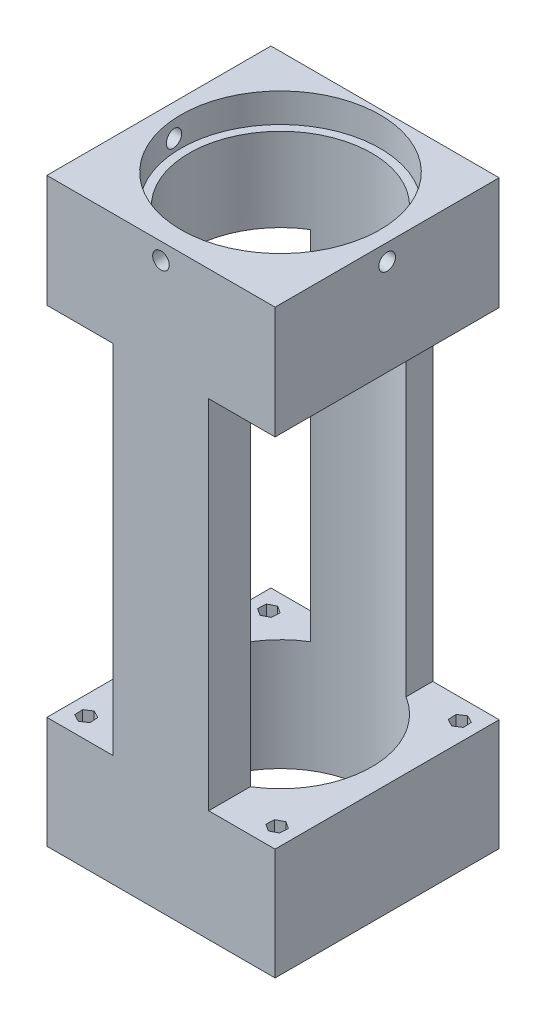
from build123d import *

# Parameters (mm, degrees)
SKETCH_1_W               = 55
SKETCH_1_H               = 140
EXTRUDE_1_DEPTH          = 54
SKETCH_2_R               = 22
CUT_EXTRUDE_1_DEPTH      = 153.552449997
CUT_EXTRUDE_2_REACH      = 94.586
SKETCH_3_W               = 16
SKETCH_3_H               = 86
SKETCH_4_R               = 24
CUT_EXTRUDE_3_DEPTH      = 7
SKETCH_5_R               = 2
CUT_EXTRUDE_4_DEPTH      = 105.120122935
SKETCH_6_R               = 2
CUT_EXTRUDE_5_DEPTH      = 20
CUT_EXTRUDE_6_DEPTH      = 3
SKETCH_8_R               = 1.6
CUT_EXTRUDE_7_DEPTH      = 131.963582875
MIRROR_3_COPY_1_DEPTH    = 3
MIRROR_3_COPY_2_SKETCH_R = 1.6
MIRROR_3_COPY_2_DEPTH    = 131.963582875
MIRROR_3_COPY_3_DEPTH    = 3
MIRROR_3_COPY_4_SKETCH_R = 1.6
MIRROR_3_COPY_4_DEPTH    = 131.963582875


with BuildPart() as part:
    # 草图1 → 凸台-拉伸1 (new body)
    with BuildSketch(Plane.XY):
        Rectangle(SKETCH_1_W, SKETCH_1_H)
    extrude(amount=EXTRUDE_1_DEPTH)

    # 草图2 → 切除-拉伸1 (cut, through all)
    with BuildSketch(Plane(origin=(0, 70, 0), x_dir=(1, 0, 0), z_dir=(0, 1, 0))):
        with Locations((0, -25.2)):
            Circle(SKETCH_2_R)
    extrude(amount=-CUT_EXTRUDE_1_DEPTH, mode=Mode.SUBTRACT)

    # 草图3 → 切除-拉伸2 (cut, up to next)
    with BuildSketch(Plane.XY.offset(54), mode=Mode.PRIVATE) as cut_extrude_2_sk1:
        with Locations((19.5, -0.1)):
            Rectangle(SKETCH_3_W, SKETCH_3_H)
    cut_extrude_2_tool1 = extrude(cut_extrude_2_sk1.sketch, amount=-CUT_EXTRUDE_2_REACH, mode=Mode.PRIVATE) & part.part
    cut_extrude_2 = cut_extrude_2_tool1.solids().sort_by_distance((19.5, -0.1, 54))[0]
    add(cut_extrude_2, mode=Mode.SUBTRACT)

    # 镜向1: 切除-拉伸2 across plane
    add(cut_extrude_2.mirror(Plane(origin=(0, 0, 0), x_dir=(0, 0, 1), z_dir=(1, 0, 0))), mode=Mode.SUBTRACT)

    # 草图4 → 切除-拉伸3 (cut)
    with BuildSketch(Plane(origin=(0, 70, 0), x_dir=(1, 0, 0), z_dir=(0, 1, 0))):
        with Locations((0, -25.2)):
            Circle(SKETCH_4_R)
    extrude(amount=-CUT_EXTRUDE_3_DEPTH, mode=Mode.SUBTRACT)

    # 草图5 → 切除-拉伸4 (cut, through all)
    with BuildSketch(Plane(origin=(27.5, 0, 0), x_dir=(0, 0, -1), z_dir=(1, 0, 0))):
        with Locations((-27, 66)):
            Circle(SKETCH_5_R)
    extrude(amount=-CUT_EXTRUDE_4_DEPTH, mode=Mode.SUBTRACT)

    # 草图6 → 切除-拉伸5 (cut)
    with BuildSketch(Plane.XY.offset(54)):
        with Locations((0, 66)):
            Circle(SKETCH_6_R)
    extrude(amount=-CUT_EXTRUDE_5_DEPTH, mode=Mode.SUBTRACT)

    # 草图7 → 切除-拉伸6 (cut)
    with BuildSketch(Plane(origin=(0, -43.1, 0), x_dir=(1, 0, 0), z_dir=(0, 1, 0))):
        Polygon((-24.79789539, -48.07755461), (-24.697808837, -50.095800386), (-22.899913446, -51.018245777), (-21.20210461, -49.92244539), (-21.302191163, -47.904199614), (-23.100086554, -46.981754223), align=None)
    cut_extrude_6 = extrude(amount=-CUT_EXTRUDE_6_DEPTH, mode=Mode.SUBTRACT)

    # 草图8 → 切除-拉伸7 (cut, through all)
    with BuildSketch(Plane(origin=(0, -46.1, 0), x_dir=(1, 0, 0), z_dir=(0, 1, 0))):
        with Locations((-23, -49)):
            Circle(SKETCH_8_R)
    cut_extrude_7 = extrude(amount=-CUT_EXTRUDE_7_DEPTH, mode=Mode.SUBTRACT)

    # 镜向2: 切除-拉伸6, 切除-拉伸7 across plane
    add(cut_extrude_6.mirror(Plane(origin=(0, 0, 0), x_dir=(0, 0, 1), z_dir=(1, 0, 0))), mode=Mode.SUBTRACT)
    add(cut_extrude_7.mirror(Plane(origin=(0, 0, 0), x_dir=(0, 0, 1), z_dir=(1, 0, 0))), mode=Mode.SUBTRACT)

    # 镜向3 copy 1 sketch → 镜向3 copy 1 (cut)
    with BuildSketch(Plane(origin=(0, -43.1, 54), x_dir=(-1, 0, 0), z_dir=(0, 1, 0))):
        Polygon((-24.79789539, -48.07755461), (-24.697808837, -50.095800386), (-22.899913446, -51.018245777), (-21.20210461, -49.92244539), (-21.302191163, -47.904199614), (-23.100086554, -46.981754223), align=None)
    extrude(amount=-MIRROR_3_COPY_1_DEPTH, mode=Mode.SUBTRACT)

    # 镜向3 copy 2 sketch → 镜向3 copy 2 (cut, through all)
    with BuildSketch(Plane(origin=(0, -46.1, 54), x_dir=(-1, 0, 0), z_dir=(0, 1, 0))):
        with Locations((-23, -49)):
            Circle(MIRROR_3_COPY_2_SKETCH_R)
    extrude(amount=-MIRROR_3_COPY_2_DEPTH, mode=Mode.SUBTRACT)

    # 镜向3 copy 3 sketch → 镜向3 copy 3 (cut)
    with BuildSketch(Plane(origin=(0, -43.1, 54), x_dir=(1, 0, 0), z_dir=(0, 1, 0))):
        Polygon((-24.79789539, 48.07755461), (-24.697808837, 50.095800386), (-22.899913446, 51.018245777), (-21.20210461, 49.92244539), (-21.302191163, 47.904199614), (-23.100086554, 46.981754223), align=None)
    extrude(amount=-MIRROR_3_COPY_3_DEPTH, mode=Mode.SUBTRACT)

    # 镜向3 copy 4 sketch → 镜向3 copy 4 (cut, through all)
    with BuildSketch(Plane(origin=(0, -46.1, 54), x_dir=(1, 0, 0), z_dir=(0, 1, 0))):
        with Locations((-23, 49)):
            Circle(MIRROR_3_COPY_4_SKETCH_R)
    extrude(amount=-MIRROR_3_COPY_4_DEPTH, mode=Mode.SUBTRACT)


solid = part.part
